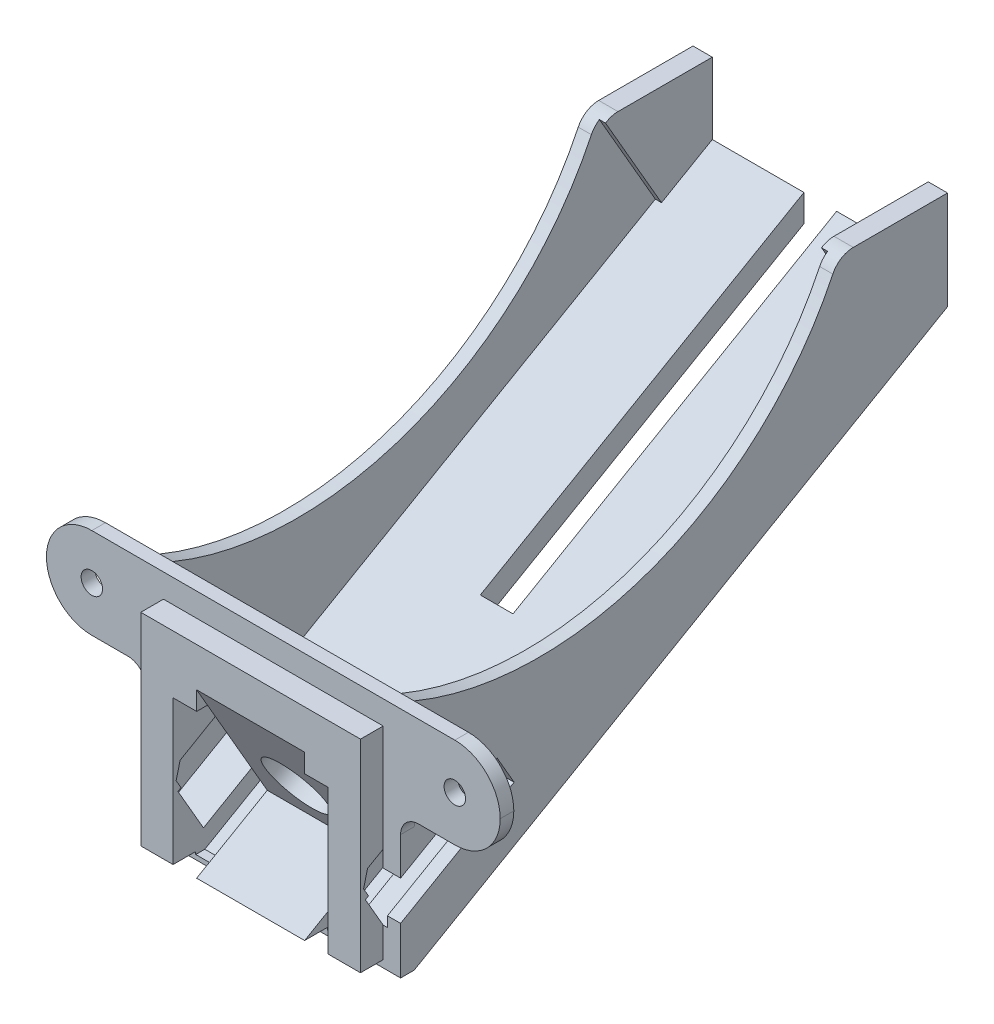
from build123d import *
from OCP.BRepAlgoAPI import BRepAlgoAPI_Cut
from OCP.TopTools import TopTools_ListOfShape

# Parameters (mm, degrees)
SKETCH2_R                       = 1.5
FRONT_PLATE_EXTRUDE_DEPTH       = 1.905
INSET_START                     = 1.905
SKETCH2_3_W                     = 30.746
SKETCH2_3_H                     = 28.321
SKETCH2_3_W_2                   = 28.746
SKETCH2_3_H_2                   = 26.321
INSET_EXTRUDE_DEPTH             = 3.175
BOTTLE_HOLDER_EXTRUDE_DEPTH     = 17.8125
BOTTLE_HOLDER_CUTOUT_DEPTH      = 15.113
SKETCH3_4_R                     = 45.655613694
ACCESS_HOLE_CUT1_DEPTH          = 7.555489588
SIPPER_HOLE_CUT_REACH           = 93.898
SKETCH6_R                       = 4.3968797
IR_LENS_1_DEPTH                 = 3.302
IR_START                        = 15.110979
IR_LENS_2_DEPTH                 = 3.302
IR_SLOT_CUT_OUTLINE_W           = 4.515510412
IR_SLOT_CUT_OUTLINE_H           = 10.146865
IR_SLOT_CUT_DEPTH               = 78.926684549
IR_MATRL_FILL_1_DEPTH           = 4.515510412
IR_START_2                      = -26.23049
IR_MATRL_FILL_2_DEPTH           = 4.515510412
CUT_EXTRUDE3_DEPTH              = 19.05
CUT_EXTRUDE3_DEPTH_BACK         = 7.62
SKETCH8_5_W                     = 2.439500062
SKETCH8_5_H                     = 4.7500002
CUT_EXTRUDE10_REACH             = 93.898
SKETCH32_W                      = 0.5999988
SKETCH32_H                      = 8.146865
CUT_EXTRUDE10_DIRECTION_2_REACH = 93.898
BOSS_EXTRUDE4_DEPTH             = 1.5
BOSS_EXTRUDE5_START             = -21.714979
BOSS_EXTRUDE5_DEPTH             = 1.5
FILLET4_R                       = 6.35
FILLET6_R                       = 3.175
SKETCH19_W                      = 4.572
SKETCH19_H                      = 52.293761458
WIRE_SLOT_CUT_DEPTH             = 87.445300984
FILLET9_R                       = 2.54
CUT_EXTRUDE11_REACH             = 86.319
SKETCH35_W                      = 0.8599988
SKETCH35_H                      = 17.011686888
FILLET10_START                  = -12.206513125
FILLET10_DEPTH                  = 1.838259089
FILLET10_START_2                = -10.368254036
FILLET10_2_DEPTH                = 1.274362516
FILLET10_START_3                = -9.318765864
FILLET10_3_DEPTH                = 1.318765864


with BuildPart() as part:
    # Sketch2 → Front Plate Extrude (new body)
    with BuildSketch(Plane.XY):
        Polygon((-31.75, 6.35), (31.75, 6.35), (31.75, -6.35), (17.812500062, -6.35), (17.812500062, -26.273), (-17.812500062, -26.273), (-17.812500062, -6.35), (-31.75, -6.35), align=None)
        with Locations(Location((-25.4, 0, 0), (0, 0, 180))):
            Circle(SKETCH2_R, mode=Mode.SUBTRACT)
        with Locations(Location((25.4, 0, 0), (0, 0, 180))):
            Circle(SKETCH2_R, mode=Mode.SUBTRACT)
    extrude(amount=FRONT_PLATE_EXTRUDE_DEPTH)

    # Sketch2<3> → Inset Extrude (add)
    # profile 1 of 2: a face of its own
    with BuildSketch(Plane.XY.offset(INSET_START)):
        with Locations((0, -11.1125)):
            Rectangle(SKETCH2_3_W, SKETCH2_3_H)
        with Locations((0, -11.1125)):
            Rectangle(SKETCH2_3_W_2, SKETCH2_3_H_2, mode=Mode.SUBTRACT)
    # profile 2 of 2: a face of its own
    with BuildSketch(Plane.XY.offset(INSET_START)):
        with Locations((0, -11.1125)):
            Rectangle(SKETCH2_3_W_2, SKETCH2_3_H_2)
    extrude(amount=INSET_EXTRUDE_DEPTH)

    # Sketch3 → Bottle Holder Extrude (add, symmetric)
    with BuildSketch(Plane(origin=(0, 0, 0), x_dir=(0, 0, -1), z_dir=(1, 0, 0))):
        with BuildLine():
            Line((0, 6.35), (0, -26.273))
            Line((0, -26.273), (74.637698823, 16.819095507))
            Line((74.637698823, 16.819095507), (74.637698823, 30.598392845))
            Line((74.637698823, 30.598392845), (59.397698823, 30.598392845))
            ThreePointArc((59.397698823, 30.598392845), (34.675938772, 6.282557302), (0, 6.35))
        make_face()
    extrude(amount=BOTTLE_HOLDER_EXTRUDE_DEPTH, both=True)

    # Sketch3<7> → Bottle Holder Cutout (cut, symmetric)
    with BuildSketch(Plane(origin=(0, 0, 0), x_dir=(0, 0, -1), z_dir=(1, 0, 0))):
        with BuildLine():
            ThreePointArc((59.397698823, 30.598392845), (34.675938772, 6.282557302), (0, 6.35))
            Line((0, 6.35), (8.989714143, -14.111334078))
            Line((8.989714143, -14.111334078), (41.609102242, 4.721478422))
            Line((41.609102242, 4.721478422), (42.984102242, 2.339908562))
            Line((42.984102242, 2.339908562), (74.637698823, 20.615121069))
            Line((74.637698823, 20.615121069), (74.637698823, 30.598392845))
            Line((74.637698823, 30.598392845), (59.397698823, 30.598392845))
        make_face()
        Polygon((10.102558342, -16.64425966), (8.989714143, -14.111334078), (41.609102242, 4.721478422), (42.984102242, 2.339908562), align=None)
    extrude(amount=BOTTLE_HOLDER_CUTOUT_DEPTH, both=True, mode=Mode.SUBTRACT)

    # Sketch3<4> → Access Hole Cut1 (cut, symmetric)
    with BuildSketch(Plane(origin=(0, 0, 0), x_dir=(0, 0, -1), z_dir=(1, 0, 0))):
        with Locations((17.420114638, 48.55159556)):
            Circle(SKETCH3_4_R)
        Polygon((-5.08, -2.441874335), (4.806167412, -19.565218584), (-5.08, -25.273), align=None)
        Polygon((8.989714143, -14.111334078), (41.609102242, 4.721478422), (42.984102242, 2.339908562), (10.102558342, -16.64425966), align=None)
    extrude(amount=ACCESS_HOLE_CUT1_DEPTH, both=True, mode=Mode.SUBTRACT)

    # Sipper Hole Cut: up to this plane
    sipper_hole_cut_end = Plane(origin=(-15.113, 1.027416141, -2.338484246), z_dir=(0, 0.40224099428432425, -0.9155338237974381))
    # Sketch6 → Sipper Hole Cut (cut, up to the surface)
    with BuildSketch(Plane(origin=(0, -2.810173109, 4.867362603), x_dir=(1, 0, 0), z_dir=(0, -0.5000000000000001, 0.8660254037844386)), mode=Mode.PRIVATE) as sipper_hole_cut_sk1:
        with Locations(Location((0, -12.318755864, 0), (0, 0, 270))):
            Circle(SKETCH6_R)
    sipper_hole_cut_tool1 = split(extrude(sipper_hole_cut_sk1.sketch, amount=-SIPPER_HOLE_CUT_REACH, mode=Mode.PRIVATE), bisect_by=sipper_hole_cut_end, keep=Keep.BOTH, mode=Mode.PRIVATE)
    add(sipper_hole_cut_tool1.solids().sort_by_distance((0, -13.478529, -1.292015))[0], mode=Mode.SUBTRACT)

    # Sketch9 → IR Lens 1 (cut)
    with BuildSketch(Plane.ZY.offset(-7.555489588)):
        Polygon((-8.275871937, -20.494923109), (0.635, -25.639617421), (5.08, -25.639617421), (5.08, -5.060840174), (0.635, -5.060840174), align=None)
    extrude(amount=-IR_LENS_1_DEPTH, mode=Mode.SUBTRACT)

    # Sketch9<2> → IR Lens 2 (cut)
    with BuildSketch(Plane.ZY.offset(-7.555489588).offset(IR_START)):
        Polygon((-8.275871937, -20.494923109), (0.635, -25.639617421), (5.08, -25.639617421), (5.08, -5.060840174), (0.635, -5.060840174), align=None)
    extrude(amount=IR_LENS_2_DEPTH, mode=Mode.SUBTRACT)

    # IR Slot Cut: read off the stored shape, not the designer's step
    # IR Slot Cut outline → IR Slot Cut (cut)
    with BuildSketch(Plane(origin=(0, -42.178380842, -10.278703561), x_dir=(1, 0, 0), z_dir=(0, 0.5000000000000007, -0.8660254037844383))):
        with Locations((13.115244794, -27.274702716)):
            Rectangle(IR_SLOT_CUT_OUTLINE_W, IR_SLOT_CUT_OUTLINE_H)
        with Locations((-13.115244794, -27.274702716)):
            Rectangle(IR_SLOT_CUT_OUTLINE_W, IR_SLOT_CUT_OUTLINE_H)
    extrude(amount=IR_SLOT_CUT_DEPTH, mode=Mode.SUBTRACT)

    # Sketch31 → IR Matrl Fill 1 (add)
    with BuildSketch(Plane(origin=(15.373, 0, 0), x_dir=(0, 0, -1), z_dir=(1, 0, 0))):
        Polygon((-4.090132963, -13.121823327), (-5.08, -13.693323327), (-5.08, -15.576325935), (-4.395369047, -16.76214153), (-3.962357211, -16.51214203), (-4.64949122, -15.321991015), align=None)
    extrude(amount=-IR_MATRL_FILL_1_DEPTH)

    # Sketch31<2> → IR Matrl Fill 2 (add)
    with BuildSketch(Plane(origin=(15.373, 0, 0), x_dir=(0, 0, -1), z_dir=(1, 0, 0)).offset(IR_START_2)):
        Polygon((-4.090132963, -13.121823327), (-5.08, -13.693323327), (-5.08, -15.576325935), (-4.395369047, -16.76214153), (-3.962357211, -16.51214203), (-4.64949122, -15.321991015), align=None)
    extrude(amount=-IR_MATRL_FILL_2_DEPTH)

    # Sketch8<5> → Cut-Extrude3 (cut, two sides: drawn at the far end of the back side and taken through both)
    with BuildSketch(Plane(origin=(0, -42.178380842, -10.278703561), x_dir=(1, 0, 0), z_dir=(0, 0.5000000000000007, -0.8660254037844383)).offset(-CUT_EXTRUDE3_DEPTH_BACK)):
        with Locations((16.592750031, -27.973135116)):
            Rectangle(SKETCH8_5_W, SKETCH8_5_H)
        with Locations((-16.592750031, -27.973135116)):
            Rectangle(SKETCH8_5_W, SKETCH8_5_H)
    extrude(amount=CUT_EXTRUDE3_DEPTH + CUT_EXTRUDE3_DEPTH_BACK, mode=Mode.SUBTRACT)

    # Cut-Extrude10: up to this face of the body (flat: up to its plane)
    cut_extrude10_end = Plane(part.part.faces().sort_by_distance((15.243, 20.905546866, -64.993866059))[0])
    # Sketch32 → Cut-Extrude10 (cut, up to the picked face)
    with BuildSketch(Plane(origin=(0, -2.810173109, 4.867362603), x_dir=(1, 0, 0), z_dir=(0, -0.5000000000000007, 0.8660254037844384)), mode=Mode.PRIVATE) as cut_extrude10_sk1:
        with Locations((15.6729994, -15.392198364)):
            Rectangle(SKETCH32_W, SKETCH32_H)
    cut_extrude10_tool1 = split(extrude(cut_extrude10_sk1.sketch, amount=-CUT_EXTRUDE10_REACH, mode=Mode.PRIVATE), bisect_by=cut_extrude10_end, keep=Keep.BOTH, mode=Mode.PRIVATE)
    # Sketch32 → Cut-Extrude10 (cut, up to the picked face)
    with BuildSketch(Plane(origin=(0, -2.810173109, 4.867362603), x_dir=(1, 0, 0), z_dir=(0, -0.5000000000000007, 0.8660254037844384)), mode=Mode.PRIVATE) as cut_extrude10_sk2:
        with Locations((-15.6729994, -15.392198364)):
            Rectangle(SKETCH32_W, SKETCH32_H)
    cut_extrude10_tool2 = split(extrude(cut_extrude10_sk2.sketch, amount=-CUT_EXTRUDE10_REACH, mode=Mode.PRIVATE), bisect_by=cut_extrude10_end, keep=Keep.BOTH, mode=Mode.PRIVATE)
    add(cut_extrude10_tool1.solids().sort_by(Axis((15.672999, -16.140208, -2.828737), (0, 0.5000000000000007, -0.8660254037844384)))[0], mode=Mode.SUBTRACT)
    add(cut_extrude10_tool2.solids().sort_by(Axis((-15.672999, -16.140208, -2.828737), (0, 0.5000000000000007, -0.8660254037844384)))[0], mode=Mode.SUBTRACT)

    # Cut-Extrude10 direction 2: up to this face of the body (flat: up to its plane)
    cut_extrude10_direction_2_end = Plane(part.part.faces().sort_by_distance((13.115244794, -19.856829184, 2.608650297))[0])
    # Sketch32 → Cut-Extrude10 direction 2 (cut, up to the picked face)
    with BuildSketch(Plane(origin=(0, -2.810173109, 4.867362603), x_dir=(1, 0, 0), z_dir=(0, -0.5000000000000007, 0.8660254037844384)), mode=Mode.PRIVATE) as cut_extrude10_direction_2_sk1:
        with Locations((15.6729994, -15.392198364)):
            Rectangle(SKETCH32_W, SKETCH32_H)
    cut_extrude10_direction_2_tool1 = split(extrude(cut_extrude10_direction_2_sk1.sketch, amount=CUT_EXTRUDE10_DIRECTION_2_REACH, mode=Mode.PRIVATE), bisect_by=cut_extrude10_direction_2_end, keep=Keep.BOTH, mode=Mode.PRIVATE)
    # Sketch32 → Cut-Extrude10 direction 2 (cut, up to the picked face)
    with BuildSketch(Plane(origin=(0, -2.810173109, 4.867362603), x_dir=(1, 0, 0), z_dir=(0, -0.5000000000000007, 0.8660254037844384)), mode=Mode.PRIVATE) as cut_extrude10_direction_2_sk2:
        with Locations((-15.6729994, -15.392198364)):
            Rectangle(SKETCH32_W, SKETCH32_H)
    cut_extrude10_direction_2_tool2 = split(extrude(cut_extrude10_direction_2_sk2.sketch, amount=CUT_EXTRUDE10_DIRECTION_2_REACH, mode=Mode.PRIVATE), bisect_by=cut_extrude10_direction_2_end, keep=Keep.BOTH, mode=Mode.PRIVATE)
    add(cut_extrude10_direction_2_tool1.solids().sort_by(Axis((15.672999, -16.140208, -2.828737), (0, -0.5000000000000007, 0.8660254037844384)))[0], mode=Mode.SUBTRACT)
    add(cut_extrude10_direction_2_tool2.solids().sort_by(Axis((-15.672999, -16.140208, -2.828737), (0, -0.5000000000000007, 0.8660254037844384)))[0], mode=Mode.SUBTRACT)

    # Sketch34 → Boss-Extrude4 (add)
    with BuildSketch(Plane(origin=(10.857489588, 0, 0), x_dir=(0, 0, -1), z_dir=(1, 0, 0))):
        Polygon((6.805761449, -9.140476832), (10.102558342, -16.64425966), (14.227004327, -14.26300966), (10.930207434, -6.759226832), align=None)
    extrude(amount=-BOSS_EXTRUDE4_DEPTH)

    # Sketch34<2> → Boss-Extrude5 (add)
    with BuildSketch(Plane(origin=(10.857489588, 0, 0), x_dir=(0, 0, -1), z_dir=(1, 0, 0)).offset(BOSS_EXTRUDE5_START)):
        Polygon((6.805761449, -9.140476832), (10.102558342, -16.64425966), (14.227004327, -14.26300966), (10.930207434, -6.759226832), align=None)
    extrude(amount=BOSS_EXTRUDE5_DEPTH)

    # Fillet4
    fillet4_edges = [part.edges().sort_by_distance(p)[0] for p in [
        (-31.75, -6.35, 0.9525),
        (31.75, -6.35, 0.9525),
        (31.75, 6.35, 0.9525),
        (-31.75, 6.35, 0.9525),
    ]]
    fillet(fillet4_edges, radius=FILLET4_R - 0.0001)  # a hair under: the kernel refuses the full size

    # Fillet6
    fillet6_edges = [part.edges().sort_by_distance(p)[0] for p in [
        (16.46275, 30.598392845, -59.397698823),
        (-16.46275, 30.598392845, -59.397698823),
    ]]
    fillet(fillet6_edges, radius=FILLET6_R)

    # Sketch19 → Wire Slot Cut (cut, through all)
    with BuildSketch(Plane(origin=(0, -16.857730829, -9.732815432), x_dir=(1, 0, 0), z_dir=(0, 0.8660254037844386, 0.5000000000000002))):
        with Locations((0, 48.798823066)):
            Rectangle(SKETCH19_W, SKETCH19_H)
    extrude(amount=-WIRE_SLOT_CUT_DEPTH, mode=Mode.SUBTRACT)

    # Fillet9
    fillet9_edges = [part.edges().sort_by_distance(p)[0] for p in [
        (17.812500062, -6.35, 0.9525),
        (-17.812500062, -6.35, 0.9525),
    ]]
    fillet(fillet9_edges, radius=FILLET9_R)

    # Cut-Extrude11: up to this face of the body (flat: up to its plane)
    cut_extrude11_end = Plane(part.part.faces().sort_by_distance((15.522272109, 20.343088544, -65.318601523))[0])
    # Sketch35 → Cut-Extrude11 (cut, up to the picked face)
    with BuildSketch(Plane(origin=(0, 1.027416141, -2.338484246), x_dir=(-1, 0, 0), z_dir=(0, 0.4022409942843238, -0.9155338237974383)), mode=Mode.PRIVATE) as cut_extrude11_sk1:
        with Locations((-15.5429994, -2.692203663)):
            Rectangle(SKETCH35_W, SKETCH35_H)
    cut_extrude11_tool1 = split(extrude(cut_extrude11_sk1.sketch, amount=CUT_EXTRUDE11_REACH, mode=Mode.PRIVATE), bisect_by=cut_extrude11_end, keep=Keep.BOTH, mode=Mode.PRIVATE)
    # Sketch35 → Cut-Extrude11 (cut, up to the picked face)
    with BuildSketch(Plane(origin=(0, 1.027416141, -2.338484246), x_dir=(-1, 0, 0), z_dir=(0, 0.4022409942843238, -0.9155338237974383)), mode=Mode.PRIVATE) as cut_extrude11_sk2:
        with Locations((15.5429994, -2.692203663)):
            Rectangle(SKETCH35_W, SKETCH35_H)
    cut_extrude11_tool2 = split(extrude(cut_extrude11_sk2.sketch, amount=CUT_EXTRUDE11_REACH, mode=Mode.PRIVATE), bisect_by=cut_extrude11_end, keep=Keep.BOTH, mode=Mode.PRIVATE)
    add(cut_extrude11_tool1.solids().sort_by(Axis((15.542999, -1.437387, -3.421399), (0, 0.4022409942843238, -0.9155338237974383)))[0], mode=Mode.SUBTRACT)
    add(cut_extrude11_tool2.solids().sort_by(Axis((-15.542999, -1.437387, -3.421399), (0, 0.4022409942843238, -0.9155338237974383)))[0], mode=Mode.SUBTRACT)


with BuildPart() as fillet10_tool:
    # Fillet10: read off the stored shape, not the designer's step
    # Fillet10 outline → Fillet10 (new body)
    with BuildSketch(Plane(origin=(0, 0, 0), x_dir=(1, 0, 0), z_dir=(0, 0.9155338237977622, 0.40224099428358634)).offset(FILLET10_START)):
        with BuildLine():
            Line((15.373, 2.554230314), (15.373, -0.656374007))
            add(Edge.make_bspline(
                [(15.373, -0.656374007), (15.373, 1.004992141), (15.9729988, 2.554230314)],
                knots=[0, 0, 0, 1, 1, 1], degree=2, weights=[1, 0.052631579, 1]))
            Line((15.9729988, 2.554230314), (15.373, 2.554230314))
        make_face()
        with BuildLine():
            Line((-15.373, -0.656374007), (-15.373, 2.554230314))
            Line((-15.373, 2.554230314), (-15.9729988, 2.554230314))
            add(Edge.make_bspline(
                [(-15.373, -0.656374007), (-15.373, 1.004992141), (-15.9729988, 2.554230314)],
                knots=[0, 0, 0, 1, 1, 1], degree=2, weights=[1, 0.052631579, 1]))
        make_face()
    extrude(amount=FILLET10_DEPTH)


with BuildPart() as part_1:
    add(part.part)

    # Fillet10: cut by fillet10_tool, with a tolerance
    fillet10_stock = TopTools_ListOfShape()
    fillet10_stock.Append(part_1.part.wrapped)
    fillet10_tools = TopTools_ListOfShape()
    fillet10_tools.Append(fillet10_tool.part.wrapped)
    fillet10_cut = BRepAlgoAPI_Cut()
    fillet10_cut.SetArguments(fillet10_stock)
    fillet10_cut.SetTools(fillet10_tools)
    fillet10_cut.SetFuzzyValue(0.00001)
    fillet10_cut.Build()
    add(Compound.cast(fillet10_cut.Shape()).solids(), mode=Mode.REPLACE)


with BuildPart() as fillet10_2_tool:
    # Fillet10 2 outline → Fillet10 2 (new body)
    with BuildSketch(Plane(origin=(0, 0, 0), x_dir=(1, 0, 0), z_dir=(0, 0.9155338237977622, 0.40224099428358634)).offset(FILLET10_START_2)):
        with BuildLine():
            Line((15.373, 2.554230314), (15.373, -0.656374007))
            add(Edge.make_bspline(
                [(15.373, -0.656374007), (15.373, 1.004992141), (15.9729988, 2.554230314)],
                knots=[0, 0, 0, 1, 1, 1], degree=2, weights=[1, 0.052631579, 1]))
            Line((15.9729988, 2.554230314), (15.373, 2.554230314))
        make_face()
        with BuildLine():
            Line((-15.373, -0.656374007), (-15.373, 2.554230314))
            Line((-15.373, 2.554230314), (-15.9729988, 2.554230314))
            add(Edge.make_bspline(
                [(-15.373, -0.656374007), (-15.373, 1.004992141), (-15.9729988, 2.554230314)],
                knots=[0, 0, 0, 1, 1, 1], degree=2, weights=[1, 0.052631579, 1]))
        make_face()
    extrude(amount=FILLET10_2_DEPTH)


with BuildPart() as part_2:
    add(part_1.part)

    # Fillet10 2: cut by fillet10_2_tool, with a tolerance
    fillet10_2_stock = TopTools_ListOfShape()
    fillet10_2_stock.Append(part_2.part.wrapped)
    fillet10_2_tools = TopTools_ListOfShape()
    fillet10_2_tools.Append(fillet10_2_tool.part.wrapped)
    fillet10_2_cut = BRepAlgoAPI_Cut()
    fillet10_2_cut.SetArguments(fillet10_2_stock)
    fillet10_2_cut.SetTools(fillet10_2_tools)
    fillet10_2_cut.SetFuzzyValue(0.00001)
    fillet10_2_cut.Build()
    add(Compound.cast(fillet10_2_cut.Shape()).solids(), mode=Mode.REPLACE)


with BuildPart() as fillet10_3_tool:
    # Fillet10 3 outline → Fillet10 3 (new body)
    with BuildSketch(Plane(origin=(0, 0, 0), x_dir=(1, 0, 0), z_dir=(0, 0.866025403784438, 0.500000000000001)).offset(FILLET10_START_3)):
        with BuildLine():
            Line((-15.373, -1.686119404), (-15.373, -10.103070715))
            Line((-15.373, -10.103070715), (-10.857489588, -10.103070715))
            Line((-10.857489588, -10.103070715), (-10.857489588, 1.543877668))
            Line((-10.857489588, 1.543877668), (-15.9729988, 1.543877668))
            add(Edge.make_bspline(
                [(-15.9729988, 1.543877668), (-15.971207149, 1.538076552), (-15.969571125, 1.532234755), (-15.964768513, 1.513798515), (-15.961985473, 1.501104663), (-15.954761434, 1.467993542), (-15.950341901, 1.447576091), (-15.939893171, 1.398235505), (-15.933955207, 1.369291076), (-15.910909064, 1.256006864), (-15.894158413, 1.171599572), (-15.854810276, 0.971102353), (-15.832371387, 0.854980502), (-15.801135896, 0.69193635), (-15.792183679, 0.645043415), (-15.771810979, 0.538001244), (-15.760407516, 0.477848753), (-15.735012858, 0.343448661), (-15.721040727, 0.269197458), (-15.69067164, 0.107184396), (-15.674295309, 0.019418673), (-15.64164936, -0.156311863), (-15.625380017, -0.244276729), (-15.59549522, -0.406606895), (-15.581859005, -0.48096837), (-15.557298295, -0.615503424), (-15.546353468, -0.675673292), (-15.526971999, -0.782673019), (-15.518517809, -0.829499715), (-15.489133614, -0.992793414), (-15.468343488, -1.109286023), (-15.433023894, -1.310574676), (-15.418334475, -1.395343423), (-15.399171891, -1.509305031), (-15.394325847, -1.538429955), (-15.386376005, -1.588191869), (-15.383177727, -1.608815715), (-15.378051102, -1.642281951), (-15.376100068, -1.655116427), (-15.373974731, -1.674030896), (-15.373407637, -1.680066264), (-15.373, -1.686119404)],
                knots=[0, 0, 0, 0, 0.018202258, 0.018202258, 0.057173389, 0.057173389, 0.119855118, 0.119855118, 0.208491493, 0.208491493, 0.466656687, 0.466656687, 0.821464439, 0.821464439, 0.96468403, 0.96468403, 1.148355589, 1.148355589, 1.375018616, 1.375018616, 1.642860059, 1.642860059, 1.911230264, 1.911230264, 2.138034472, 2.138034472, 2.321506022, 2.321506022, 2.464257422, 2.464257422, 2.819255112, 2.819255112, 3.077356437, 3.077356437, 3.165927054, 3.165927054, 3.22854891, 3.22854891, 3.267479779, 3.267479779, 3.28566819, 3.28566819, 3.28566819, 3.28566819], degree=3))
        make_face()
        with BuildLine():
            Line((15.9729988, 1.543877668), (10.857489588, 1.543877668))
            Line((10.857489588, 1.543877668), (10.857489588, -10.103070715))
            Line((10.857489588, -10.103070715), (15.373, -10.103070715))
            Line((15.373, -10.103070715), (15.373, -1.686119404))
            add(Edge.make_bspline(
                [(15.373, -1.686119404), (15.373407663, -1.680066011), (15.373974788, -1.674030391), (15.376100251, -1.655114986), (15.378051402, -1.642279828), (15.383178353, -1.608811675), (15.386376838, -1.588186595), (15.394327216, -1.538421551), (15.399173594, -1.509294736), (15.418337569, -1.395325297), (15.433028064, -1.310550616), (15.468350268, -1.109247726), (15.489141937, -0.992746815), (15.518527407, -0.829446507), (15.526981313, -0.782621499), (15.546362394, -0.675624158), (15.557307117, -0.615454985), (15.581867816, -0.480920241), (15.595504126, -0.406558381), (15.625389309, -0.244226402), (15.641658944, -0.15626011), (15.674304958, 0.01947046), (15.690681057, 0.10723479), (15.721049863, 0.269246081), (15.735021947, 0.343496904), (15.760416707, 0.47789729), (15.77182032, 0.538050453), (15.792193506, 0.645094937), (15.801146057, 0.691989511), (15.832380359, 0.855027003), (15.854817705, 0.971140558), (15.89416316, 1.171623556), (15.910912682, 1.256024921), (15.93395731, 1.369301319), (15.939894907, 1.398243858), (15.950343014, 1.447581327), (15.954762297, 1.467997547), (15.961985953, 1.501106758), (15.964768858, 1.51379993), (15.969571252, 1.532235248), (15.971207215, 1.538076798), (15.9729988, 1.543877668)],
                knots=[0, 0, 0, 0, 0.018189173, 0.018189173, 0.057122116, 0.057122116, 0.11974773, 0.11974773, 0.208324112, 0.208324112, 0.466443528, 0.466443528, 0.821466551, 0.821466551, 0.964212812, 0.964212812, 1.147682253, 1.147682253, 1.374487649, 1.374487649, 1.642862223, 1.642862223, 1.910699431, 1.910699431, 2.137361313, 2.137361313, 2.321034939, 2.321034939, 2.46425955, 2.46425955, 2.819041988, 2.819041988, 3.07718908, 3.07718908, 3.165819682, 3.165819682, 3.228497644, 3.228497644, 3.267466697, 3.267466697, 3.28566819, 3.28566819, 3.28566819, 3.28566819], degree=3))
        make_face()
    extrude(amount=FILLET10_3_DEPTH)


with BuildPart() as part_3:
    add(part_2.part)


with BuildPart() as part_4:
    # Fillet10 3: joined with fillet10_3_tool
    add(part_3.part.fuse(fillet10_3_tool.part, tol=0.00001))


solid = part_4.part
